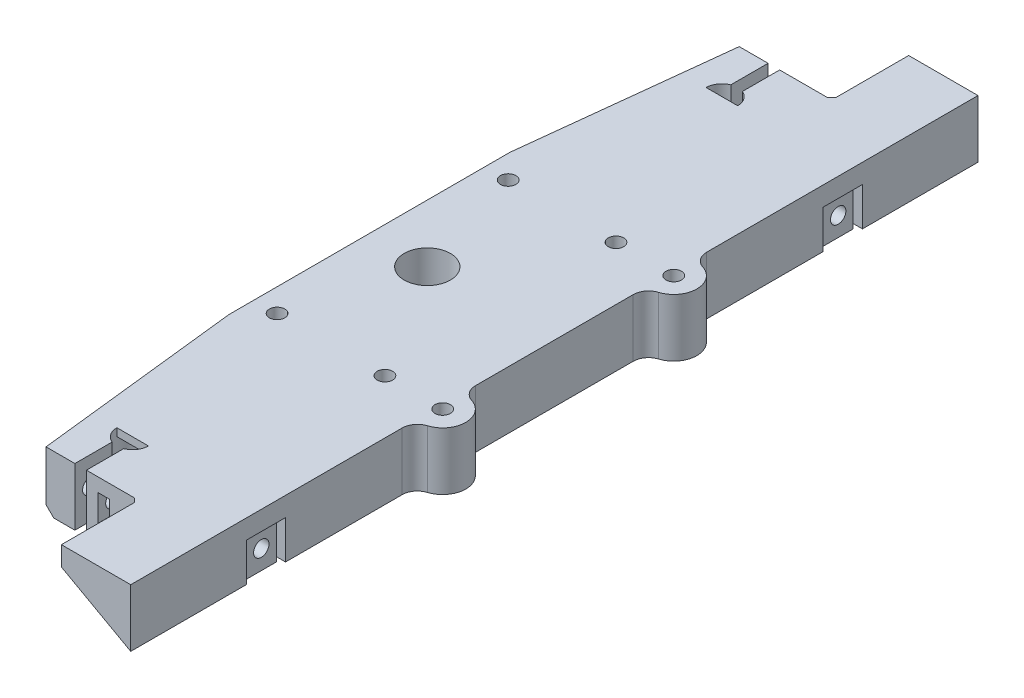
from build123d import *

# Parameters (mm, degrees)
SZKIC1_R                    = 6
SZKIC1_R_2                  = 2
DODANIE_WYCI_GNI_CIE1_DEPTH = 15
DODANIE_WYCI_GNI_CIE3_START = -2
DODANIE_WYCI_GNI_CIE3_DEPTH = 2
DODANIE_WYCI_GNI_CIE4_DEPTH = 15
SZKIC5_R                    = 2
WYTNIJ_WYCI_GNI_CIE1_DEPTH  = 15
ZAOKR_GLENIE1_R             = 4
SFAZOWANIE1_SIZE            = 2
WYTNIJ_WYCI_GNI_CIE3_START  = -7
SZKIC8_R                    = 2
WYTNIJ_WYCI_GNI_CIE3_DEPTH  = 107.031560626
WYTNIJ_WYCI_GNI_CIE4_START  = 8
SZKIC9_R                    = 3.5
WYTNIJ_WYCI_GNI_CIE4_DEPTH  = 4
WYTNIJ_WYCI_GNI_CIE5_START  = -6
SZKIC10_R                   = 2
WYTNIJ_WYCI_GNI_CIE5_DEPTH  = 3
SZKIC12_W                   = 10.2
SZKIC12_H                   = 10.2
SZKIC12_W_2                 = 7.8
SZKIC12_H_2                 = 7.8
WYTNIJ_WYCI_GNI_CIE7_DEPTH  = 10
SZKIC13_R                   = 2
WYTNIJ_WYCI_GNI_CIE8_DEPTH  = 8
DODANIE_WYCI_GNI_CIE5_DEPTH = 20
SZKIC15_R                   = 5.1
WYTNIJ_WYCI_GNI_CIE9_DEPTH  = 7
SFAZOWANIE2_SIZE            = 1


with BuildPart() as part:
    # Szkic1 → Dodanie-wyciągnięcie1 (new body)
    with BuildSketch(Plane(origin=(0, 0, 0), x_dir=(1, 0, 0), z_dir=(0, 1, 0))):
        with BuildLine():
            Line((-14.5, 90), (-20.5, 36.5))
            Line((-20.5, 36.5), (-20.5, -36.5))
            Line((-20.5, -36.5), (-14.5, -90))
            Line((-14.5, -90), (-7, -90))
            Line((-7, -90), (-7, -80.315756806))
            ThreePointArc((-7, -80.315756806), (-5.5, -72.4), (-4, -80.315756806))
            Line((-4, -80.315756806), (-4, -90))
            Line((-4, -90), (27.5, -90))
            Line((27.5, -90), (27.5, 90))
            Line((27.5, 90), (-3.999999678, 90))
            Line((-3.999999678, 90), (-4, 80.315756806))
            ThreePointArc((-4, 80.315756806), (-5.5, 72.4), (-7, 80.315756806))
            Line((-7, 80.315756806), (-6.999999678, 90))
            Line((-6.999999678, 90), (-14.5, 90))
        make_face()
        with Locations((-5.5, 0)):
            Circle(SZKIC1_R, mode=Mode.SUBTRACT)
        with Locations((-14.5, 30)):
            Circle(SZKIC1_R_2, mode=Mode.SUBTRACT)
        with Locations((13.5, 30)):
            Circle(SZKIC1_R_2, mode=Mode.SUBTRACT)
        with Locations((-14.5, -30)):
            Circle(SZKIC1_R_2, mode=Mode.SUBTRACT)
        with Locations((13.5, -30)):
            Circle(SZKIC1_R_2, mode=Mode.SUBTRACT)
    extrude(amount=DODANIE_WYCI_GNI_CIE1_DEPTH)

    # Szkic3 → Dodanie-wyciągnięcie3 (add)
    with BuildSketch(Plane(origin=(0, 15, 0), x_dir=(1, 0, 0), z_dir=(0, 1, 0)).offset(DODANIE_WYCI_GNI_CIE3_START)):
        with BuildLine():
            Line((-1.399999999, 76.5), (-9.600000001, 76.5))
            ThreePointArc((-9.600000001, 76.5), (-5.5, 72.399999999), (-1.399999999, 76.5))
        make_face()
        with BuildLine():
            ThreePointArc((-1.399999999, -76.5), (-5.5, -72.399999999), (-9.600000001, -76.5))
            Line((-9.600000001, -76.5), (-1.399999999, -76.5))
        make_face()
    extrude(amount=DODANIE_WYCI_GNI_CIE3_DEPTH)

    # Szkic4 → Dodanie-wyciągnięcie4 (add)
    with BuildSketch(Plane(origin=(0, 15, 0), x_dir=(1, 0, 0), z_dir=(0, 1, 0))):
        with BuildLine():
            ThreePointArc((27.5, -28.267949192), (30.5, -30), (27.5, -31.732050808))
            Line((27.5, -31.732050808), (27.5, -35.916079783))
            ThreePointArc((27.5, -35.916079783), (34.5, -30), (27.5, -24.083920217))
            Line((27.5, -24.083920217), (27.5, -28.267949192))
        make_face()
        with BuildLine():
            Line((27.5, 28.267949192), (27.5, 24.083920217))
            ThreePointArc((27.5, 24.083920217), (34.5, 30), (27.5, 35.916079783))
            Line((27.5, 35.916079783), (27.5, 31.732050808))
            ThreePointArc((27.5, 31.732050808), (30.5, 30), (27.5, 28.267949192))
        make_face()
    extrude(amount=-DODANIE_WYCI_GNI_CIE4_DEPTH)

    # Szkic5 → Wytnij-wyciągnięcie1 (cut)
    with BuildSketch(Plane(origin=(0, 15, 0), x_dir=(1, 0, 0), z_dir=(0, 1, 0))):
        with Locations((28.5, 30)):
            Circle(SZKIC5_R)
        with Locations((28.5, -30)):
            Circle(SZKIC5_R)
    extrude(amount=-WYTNIJ_WYCI_GNI_CIE1_DEPTH, mode=Mode.SUBTRACT)

    # Zaokrąglenie1
    zaokr_glenie1_edges = [part.edges().sort_by_distance(p)[0] for p in [
        (27.5, 7.5, -35.916079783),
        (27.5, 7.5, -24.083920217),
        (27.5, 7.5, 24.083920217),
        (27.5, 7.5, 35.916079783),
    ]]
    fillet(zaokr_glenie1_edges, radius=ZAOKR_GLENIE1_R)

    # Sfazowanie1
    sfazowanie1_edges = [part.edges().sort_by_distance(p)[0] for p in [
        (-17.5, 0, -63.25),
        (-17.5, 0, 63.25),
        (-20.5, 0, 0),
    ]]
    chamfer(sfazowanie1_edges, length=SFAZOWANIE1_SIZE)

    # Szkic8 → Wytnij-wyciągnięcie3 (cut)
    with BuildSketch(Plane.ZY.offset(4).offset(WYTNIJ_WYCI_GNI_CIE3_START)):
        with Locations((86, 8)):
            Circle(SZKIC8_R)
    wytnij_wyci_gni_cie3 = extrude(amount=WYTNIJ_WYCI_GNI_CIE3_DEPTH, mode=Mode.SUBTRACT)

    # Szkic9 → Wytnij-wyciągnięcie4 (cut)
    with BuildSketch(Plane.ZY.offset(4).offset(WYTNIJ_WYCI_GNI_CIE4_START)):
        with Locations((86, 8)):
            Circle(SZKIC9_R)
    wytnij_wyci_gni_cie4 = extrude(amount=WYTNIJ_WYCI_GNI_CIE4_DEPTH, mode=Mode.SUBTRACT)

    # Szkic10 → Wytnij-wyciągnięcie5 (cut)
    with BuildSketch(Plane.ZY.offset(4).offset(WYTNIJ_WYCI_GNI_CIE5_START)):
        Polygon((83, 6.267949192), (86, 4.535898385), (90, 4.535898385), (90, 11.464101615), (86, 11.464101615), (83, 9.732050808), align=None)
        with Locations((86, 8)):
            Circle(SZKIC10_R, mode=Mode.SUBTRACT)
    wytnij_wyci_gni_cie5 = extrude(amount=WYTNIJ_WYCI_GNI_CIE5_DEPTH, mode=Mode.SUBTRACT)

    # Lustro2: Wytnij-wyciągnięcie3, Wytnij-wyciągnięcie4, Wytnij-wyciągnięcie5 across plane
    add(wytnij_wyci_gni_cie3.mirror(Plane.XY), mode=Mode.SUBTRACT)
    add(wytnij_wyci_gni_cie4.mirror(Plane.XY), mode=Mode.SUBTRACT)
    add(wytnij_wyci_gni_cie5.mirror(Plane.XY), mode=Mode.SUBTRACT)

    # Szkic12 → Wytnij-wyciągnięcie7 (cut)
    # profile 1 of 2: a face of its own
    with BuildSketch(Plane.XZ):
        with Locations((22.4, 74.9)):
            Rectangle(SZKIC12_W, SZKIC12_H)
        with Locations((22.4, 74.9)):
            Rectangle(SZKIC12_W_2, SZKIC12_H_2, mode=Mode.SUBTRACT)
    # profile 2 of 2: a face of its own
    with BuildSketch(Plane.XZ):
        with Locations((22.4, -74.9)):
            Rectangle(SZKIC12_W, SZKIC12_H)
        with Locations((22.4, -74.9)):
            Rectangle(SZKIC12_W_2, SZKIC12_H_2, mode=Mode.SUBTRACT)
    extrude(amount=-WYTNIJ_WYCI_GNI_CIE7_DEPTH, mode=Mode.SUBTRACT)

    # Szkic13 → Wytnij-wyciągnięcie8 (cut)
    with BuildSketch(Plane(origin=(26.3, 0, 0), x_dir=(0, 0, -1), z_dir=(1, 0, 0))):
        with Locations((74.9, 5)):
            Circle(SZKIC13_R)
        with Locations((-74.9, 5)):
            Circle(SZKIC13_R)
    extrude(amount=-WYTNIJ_WYCI_GNI_CIE8_DEPTH, mode=Mode.SUBTRACT)

    # Szkic14 → Dodanie-wyciągnięcie5 (add)
    with BuildSketch(Plane(origin=(0, 0, -90), x_dir=(-1, 0, 0), z_dir=(0, 0, -1))):
        Polygon((-27.5, 15), (-27.5, 0), (-9.5, 9.977562926), (-9.5, 15), align=None)
    dodanie_wyci_gni_cie5 = extrude(amount=DODANIE_WYCI_GNI_CIE5_DEPTH)

    # Szkic15 → Wytnij-wyciągnięcie9 (cut)
    with BuildSketch(Plane(origin=(6.463610117, 11.660661322, 0), x_dir=(0.8746197071393933, -0.48480962024634155, 0), z_dir=(-0.48480962024634155, -0.8746197071393933, 0))):
        with Locations((13.371668725, -100)):
            Circle(SZKIC15_R)
    wytnij_wyci_gni_cie9 = extrude(amount=-WYTNIJ_WYCI_GNI_CIE9_DEPTH, mode=Mode.SUBTRACT)

    # Lustro4: Dodanie-wyciągnięcie5, Wytnij-wyciągnięcie9 across plane
    add(dodanie_wyci_gni_cie5.mirror(Plane.XY))
    add(wytnij_wyci_gni_cie9.mirror(Plane.XY), mode=Mode.SUBTRACT)

    # Sfazowanie2
    sfazowanie2_edges = [part.edges().sort_by_distance(p)[0] for p in [
        (9.5, 12.488781463, -90),
        (18.5, 4.988781463, -90),
        (9.5, 12.488781463, 90),
        (18.5, 4.988781463, 90),
    ]]
    chamfer(sfazowanie2_edges, length=SFAZOWANIE2_SIZE)


solid = part.part
